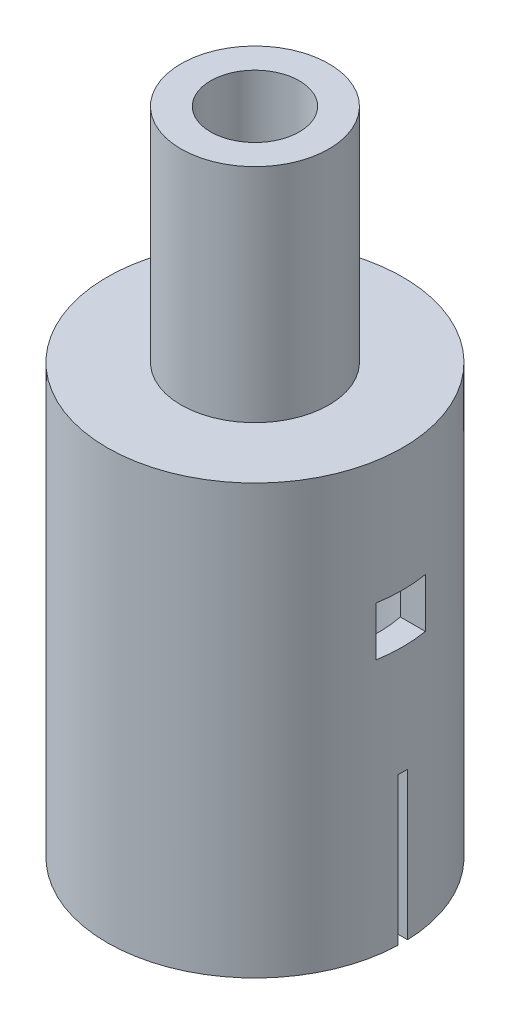
from build123d import *

# Parameters (mm, degrees)
SKETCH2_R                = 7.62
BOSS_EXTRUDE1_DEPTH      = 22.098
SKETCH3_R                = 6.35
CUT_EXTRUDE1_DEPTH       = 16.764
CUT_EXTRUDE3_DEPTH       = 16.764
CUT_EXTRUDE3_DEPTH_BACK  = 25.585573087
SKETCH5_R                = 2.3495
SKETCH6_R                = 3.81
BOSS_EXTRUDE2_DEPTH      = 11.43
SKETCH8_R                = 2.286
CUT_EXTRUDE4_DEPTH       = 11.176
CUT_EXTRUDE8_REACH       = 26.586
SKETCH10_R               = 1.719833609
CUT_EXTRUDE10_DEPTH      = 25.585573087
CUT_EXTRUDE10_DEPTH_BACK = 25.585573087
SKETCH12_W               = 2.54
SKETCH12_H               = 2.54
SKETCH16_W               = 22.098123612
SKETCH16_H               = 0.508
CUT_EXTRUDE16_DEPTH      = 7.62


with BuildPart() as part:
    # Sketch2 → Boss-Extrude1 (new body)
    with BuildSketch(Plane(origin=(0, 0, 0), x_dir=(1, 0, 0), z_dir=(0, 1, 0))):
        Circle(SKETCH2_R)
    extrude(amount=-BOSS_EXTRUDE1_DEPTH)

    # Sketch3 → Cut-Extrude1 (cut)
    with BuildSketch(Plane.XZ.offset(22.098)):
        Circle(SKETCH3_R)
    extrude(amount=-CUT_EXTRUDE1_DEPTH, mode=Mode.SUBTRACT)

    # Sketch5 → Cut-Extrude3 (cut, two sides: drawn at the far end of the back side and taken through both)
    with BuildSketch(Plane(origin=(0, 0, 0), x_dir=(1, 0, 0), z_dir=(0, 1, 0)).offset(-CUT_EXTRUDE3_DEPTH_BACK)):
        Circle(SKETCH5_R)
    extrude(amount=CUT_EXTRUDE3_DEPTH + CUT_EXTRUDE3_DEPTH_BACK, mode=Mode.SUBTRACT)

    # Sketch6 → Boss-Extrude2 (add)
    with BuildSketch(Plane(origin=(0, 0, 0), x_dir=(1, 0, 0), z_dir=(0, 1, 0))):
        Circle(SKETCH6_R)
    extrude(amount=BOSS_EXTRUDE2_DEPTH)

    # Sketch8 → Cut-Extrude4 (cut)
    with BuildSketch(Plane(origin=(0, 11.43, 0), x_dir=(1, 0, 0), z_dir=(0, 1, 0))):
        Circle(SKETCH8_R)
    extrude(amount=-CUT_EXTRUDE4_DEPTH, mode=Mode.SUBTRACT)

    # Sketch10 → Cut-Extrude8 (cut, up to next)
    with BuildSketch(Plane.XZ, mode=Mode.PRIVATE) as cut_extrude8_sk1:
        Circle(SKETCH10_R)
    cut_extrude8_tool1 = extrude(cut_extrude8_sk1.sketch, amount=-CUT_EXTRUDE8_REACH, mode=Mode.PRIVATE) & part.part
    add(cut_extrude8_tool1.solids().sort_by_distance((0, 0, 0))[0], mode=Mode.SUBTRACT)

    # Sketch12 → Cut-Extrude10 (cut, two sides: drawn at the far end of the back side and taken through both)
    with BuildSketch(Plane(origin=(0, 0, 0), x_dir=(0, 0, -1), z_dir=(1, 0, 0)).offset(-CUT_EXTRUDE10_DEPTH_BACK)):
        with Locations((0, -7.62)):
            Rectangle(SKETCH12_W, SKETCH12_H)
    extrude(amount=CUT_EXTRUDE10_DEPTH + CUT_EXTRUDE10_DEPTH_BACK, mode=Mode.SUBTRACT)

    # Sketch16 → Cut-Extrude16 (cut)
    with BuildSketch(Plane.XZ.offset(22.098)):
        Rectangle(SKETCH16_W, SKETCH16_H)
    extrude(amount=-CUT_EXTRUDE16_DEPTH, mode=Mode.SUBTRACT)


solid = part.part
